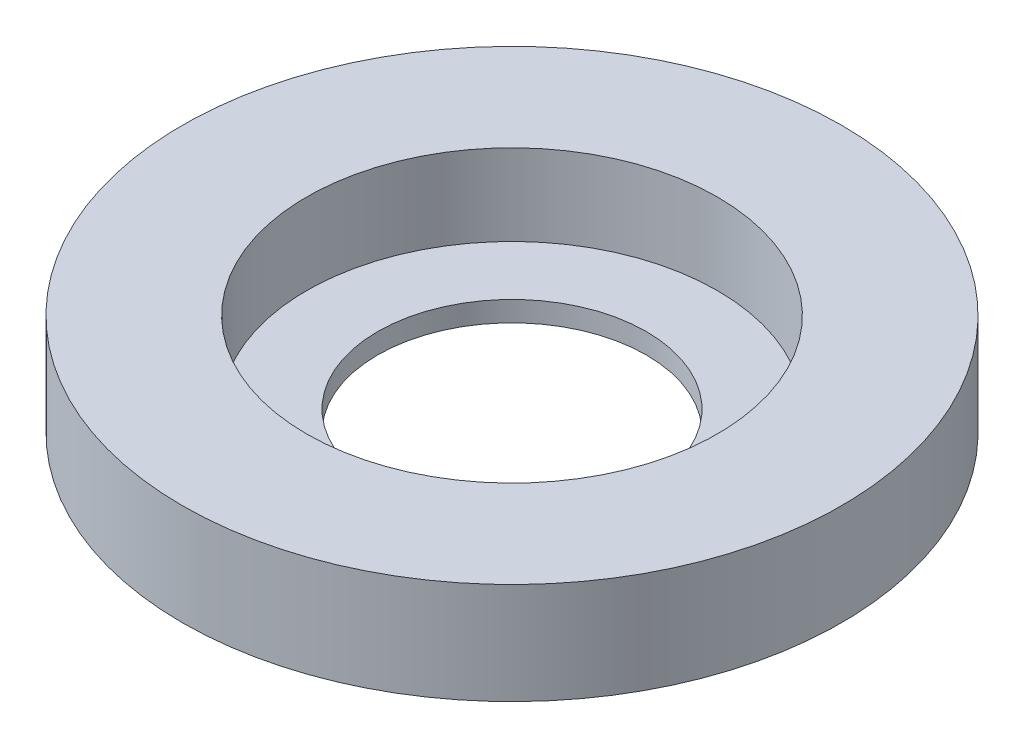
from build123d import *


with BuildPart() as part:
    # Sketch1 → Revolve1 (revolve)
    with BuildSketch(Plane.XY):
        Polygon((5.3, 0), (13, 0), (13, 4), (8.1, 4), (8.1, 0.8), (5.3, 0.8), align=None)
    revolve(axis=Axis((0, 0, 0), (0, 1, 0)))


solid = part.part
